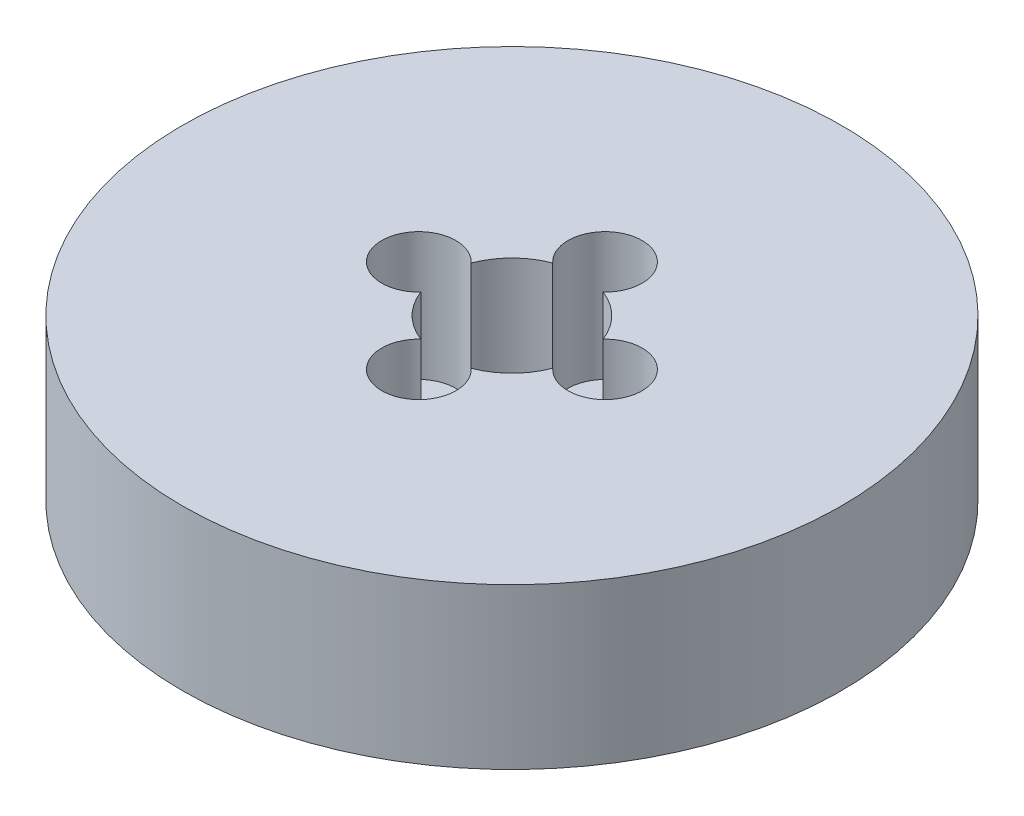
from build123d import *

# Parameters (mm, degrees)
SKETCH1_R           = 35
BOSS_EXTRUDE1_DEPTH = 17
SKETCH2_R           = 7.5
CUT_EXTRUDE1_DEPTH  = 53.335456433
SKETCH3_R           = 3.934640136
CUT_EXTRUDE2_DEPTH  = 13.598112287
CIRPATTERN1_COUNT   = 4


with BuildPart() as part:
    # Sketch1 → Boss-Extrude1 (new body)
    with BuildSketch(Plane(origin=(0, 0, 0), x_dir=(1, 0, 0), z_dir=(0, 1, 0))):
        Circle(SKETCH1_R)
    extrude(amount=BOSS_EXTRUDE1_DEPTH)

    # Sketch2 → Cut-Extrude1 (cut, through all)
    with BuildSketch(Plane(origin=(0, 0, 0), x_dir=(1, 0, 0), z_dir=(0, 1, 0))):
        Circle(SKETCH2_R)
    extrude(amount=CUT_EXTRUDE1_DEPTH, mode=Mode.SUBTRACT)

    # Sketch3 → Cut-Extrude2 (cut)
    with BuildSketch(Plane(origin=(0, 17, 0), x_dir=(1, 0, 0), z_dir=(0, 1, 0))):
        with Locations((-9.889323283, 0)):
            Circle(SKETCH3_R)
    cut_extrude2 = extrude(amount=-CUT_EXTRUDE2_DEPTH, mode=Mode.SUBTRACT)

    # CirPattern1: Cut-Extrude2 ×4 about axis
    cirpattern1_axis = Axis((0, 0, 0), (0, 1, 0))
    for i in range(1, CIRPATTERN1_COUNT):
        add(cut_extrude2.rotate(cirpattern1_axis, i * 360 / CIRPATTERN1_COUNT), mode=Mode.SUBTRACT)


solid = part.part
